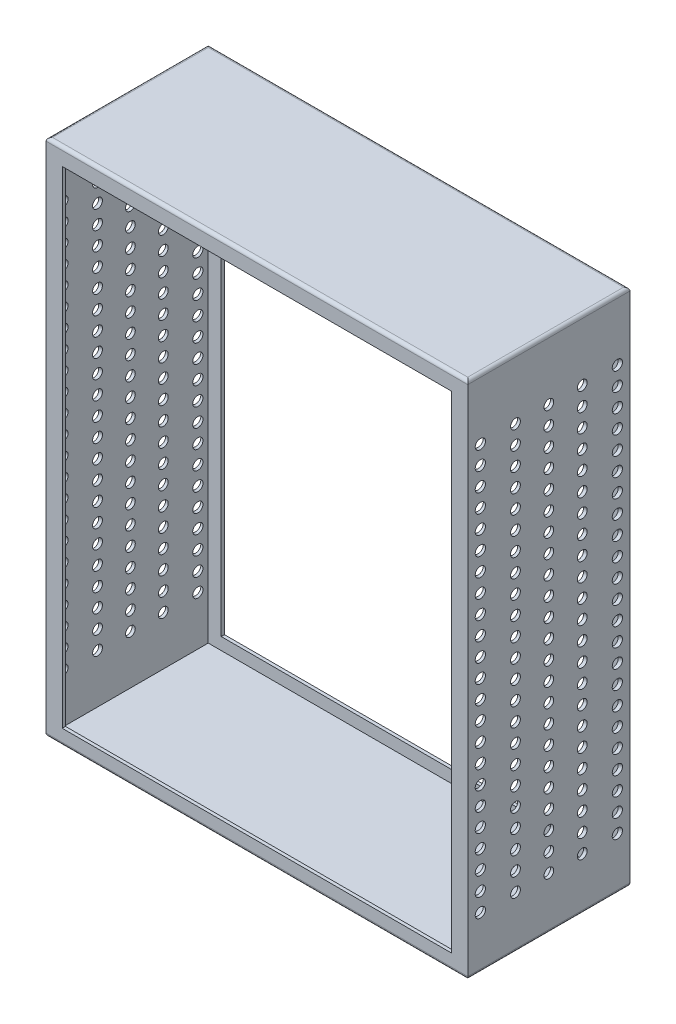
from build123d import *

# Parameters (mm, degrees)
SKETCH2_W               = 330.2
SKETCH2_H               = 406.4
BOSS_EXTRUDE1_DEPTH     = 127
FILLET1_R               = 2.54
FILLET2_R               = 2.54
SKETCH3_W               = 304.8
SKETCH3_H               = 381
CUT_EXTRUDE1_DEPTH      = 127
SHELL4_START            = 2.54
SHELL4_OUTLINE_W        = 401.32
SHELL4_OUTLINE_H        = 121.92
SHELL4_DEPTH            = 325.12
SKETCH6_R               = 3.81
CUT_EXTRUDE4_DEPTH      = 539.815367264
LPATTERN1_COUNT         = 23
LPATTERN1_PITCH         = 14.440000076
CIRPATTERN2_START       = 5.239496477
CIRPATTERN2_OUTLINE_R   = 3.81
CIRPATTERN2_DEPTH       = 335.522874171
CIRPATTERN2_START_2     = 1.807652619
CIRPATTERN2_2_OUTLINE_R = 3.81
CIRPATTERN2_2_DEPTH     = 349.668714729
CIRPATTERN2_START_3     = -37.437505667
CIRPATTERN2_3_OUTLINE_R = 3.81
CIRPATTERN2_3_DEPTH     = 349.668714729
CIRPATTERN2_START_4     = -14.627680583
CIRPATTERN2_4_OUTLINE_R = 3.81
CIRPATTERN2_4_DEPTH     = 335.52287417


# Read off the part's stored shape, not the designer's step: Shell4, CirPattern2
with BuildPart() as part:
    # Sketch2 → Boss-Extrude1 (new body)
    with BuildSketch(Plane.XY):
        with Locations((165.1, 203.2)):
            Rectangle(SKETCH2_W, SKETCH2_H)
    extrude(amount=BOSS_EXTRUDE1_DEPTH)

    # Fillet1
    fillet1_edges = [part.edges().sort_by_distance(p)[0] for p in [
        (165.1, 406.4, 127),
        (165.1, 406.4, 0),
        (0, 406.4, 63.5),
        (330.2, 406.4, 63.5),
    ]]
    fillet(fillet1_edges, radius=FILLET1_R)

    # Fillet2
    fillet2_edges = [part.edges().sort_by_distance(p)[0] for p in [
        (165.1, 0, 0),
        (330.2, 0, 63.5),
        (0, 0, 63.5),
        (165.1, 0, 127),
    ]]
    fillet(fillet2_edges, radius=FILLET2_R)

    # Sketch3 → Cut-Extrude1 (cut)
    with BuildSketch(Plane.XY.offset(127)):
        with Locations((165.1, 202.565)):
            Rectangle(SKETCH3_W, SKETCH3_H)
    extrude(amount=-CUT_EXTRUDE1_DEPTH, mode=Mode.SUBTRACT)

    # Shell4 outline → Shell4 (cut)
    with BuildSketch(Plane.YZ.offset(SHELL4_START)):
        with Locations((203.2, 63.5)):
            Rectangle(SHELL4_OUTLINE_W, SHELL4_OUTLINE_H)
    extrude(amount=SHELL4_DEPTH, mode=Mode.SUBTRACT)

    # Sketch6 → Cut-Extrude4 (cut, through all)
    with BuildSketch(Plane.ZY):
        with Locations((63.5, 358.605030272)):
            Circle(SKETCH6_R)
    cut_extrude4 = extrude(amount=-CUT_EXTRUDE4_DEPTH, mode=Mode.SUBTRACT)

    # LPattern1: Cut-Extrude4 ×23
    with Locations(*[(0, -i * LPATTERN1_PITCH, 0) for i in range(1, LPATTERN1_COUNT)]):
        add(cut_extrude4, mode=Mode.SUBTRACT)

    # CirPattern2 outline → CirPattern2 (cut)
    with BuildSketch(Plane(origin=(0, 0, 0), x_dir=(0, 1, 0), z_dir=(0.9876883405951378, 0, 0.15643446504023098)).offset(CIRPATTERN2_START)):
        with Locations((40.9250286, 36.89087945)):
            Circle(CIRPATTERN2_OUTLINE_R)
        with Locations((55.365028676, 36.89087945)):
            Circle(CIRPATTERN2_OUTLINE_R)
        with Locations((69.805028752, 36.89087945)):
            Circle(CIRPATTERN2_OUTLINE_R)
        with Locations((84.245028828, 36.89087945)):
            Circle(CIRPATTERN2_OUTLINE_R)
        with Locations((98.685028904, 36.89087945)):
            Circle(CIRPATTERN2_OUTLINE_R)
        with Locations((113.12502898, 36.89087945)):
            Circle(CIRPATTERN2_OUTLINE_R)
        with Locations((127.565029056, 36.89087945)):
            Circle(CIRPATTERN2_OUTLINE_R)
        with Locations((142.005029132, 36.89087945)):
            Circle(CIRPATTERN2_OUTLINE_R)
        with Locations((156.445029208, 36.89087945)):
            Circle(CIRPATTERN2_OUTLINE_R)
        with Locations((170.885029284, 36.89087945)):
            Circle(CIRPATTERN2_OUTLINE_R)
        with Locations((185.32502936, 36.89087945)):
            Circle(CIRPATTERN2_OUTLINE_R)
        with Locations((199.765029436, 36.89087945)):
            Circle(CIRPATTERN2_OUTLINE_R)
        with Locations((214.205029512, 36.89087945)):
            Circle(CIRPATTERN2_OUTLINE_R)
        with Locations((228.645029588, 36.89087945)):
            Circle(CIRPATTERN2_OUTLINE_R)
        with Locations((243.085029664, 36.89087945)):
            Circle(CIRPATTERN2_OUTLINE_R)
        with Locations((257.52502974, 36.89087945)):
            Circle(CIRPATTERN2_OUTLINE_R)
        with Locations((271.965029816, 36.89087945)):
            Circle(CIRPATTERN2_OUTLINE_R)
        with Locations((286.405029892, 36.89087945)):
            Circle(CIRPATTERN2_OUTLINE_R)
        with Locations((300.845029968, 36.89087945)):
            Circle(CIRPATTERN2_OUTLINE_R)
        with Locations((315.285030044, 36.89087945)):
            Circle(CIRPATTERN2_OUTLINE_R)
        with Locations((329.72503012, 36.89087945)):
            Circle(CIRPATTERN2_OUTLINE_R)
        with Locations((344.165030196, 36.89087945)):
            Circle(CIRPATTERN2_OUTLINE_R)
        with Locations((358.605030272, 36.89087945)):
            Circle(CIRPATTERN2_OUTLINE_R)
    extrude(amount=CIRPATTERN2_DEPTH, mode=Mode.SUBTRACT)

    # CirPattern2 2 outline → CirPattern2 2 (cut)
    with BuildSketch(Plane(origin=(0, 0, 0), x_dir=(0, 1, 0), z_dir=(0.9510565162951534, 0, 0.3090169943749481)).offset(CIRPATTERN2_START_2)):
        with Locations((40.9250286, 9.373383013)):
            Circle(CIRPATTERN2_2_OUTLINE_R)
        with Locations((55.365028676, 9.373383013)):
            Circle(CIRPATTERN2_2_OUTLINE_R)
        with Locations((69.805028752, 9.373383013)):
            Circle(CIRPATTERN2_2_OUTLINE_R)
        with Locations((84.245028828, 9.373383013)):
            Circle(CIRPATTERN2_2_OUTLINE_R)
        with Locations((98.685028904, 9.373383013)):
            Circle(CIRPATTERN2_2_OUTLINE_R)
        with Locations((113.12502898, 9.373383013)):
            Circle(CIRPATTERN2_2_OUTLINE_R)
        with Locations((127.565029056, 9.373383013)):
            Circle(CIRPATTERN2_2_OUTLINE_R)
        with Locations((142.005029132, 9.373383013)):
            Circle(CIRPATTERN2_2_OUTLINE_R)
        with Locations((156.445029208, 9.373383013)):
            Circle(CIRPATTERN2_2_OUTLINE_R)
        with Locations((170.885029284, 9.373383013)):
            Circle(CIRPATTERN2_2_OUTLINE_R)
        with Locations((185.32502936, 9.373383013)):
            Circle(CIRPATTERN2_2_OUTLINE_R)
        with Locations((199.765029436, 9.373383013)):
            Circle(CIRPATTERN2_2_OUTLINE_R)
        with Locations((214.205029512, 9.373383013)):
            Circle(CIRPATTERN2_2_OUTLINE_R)
        with Locations((228.645029588, 9.373383013)):
            Circle(CIRPATTERN2_2_OUTLINE_R)
        with Locations((243.085029664, 9.373383013)):
            Circle(CIRPATTERN2_2_OUTLINE_R)
        with Locations((257.52502974, 9.373383013)):
            Circle(CIRPATTERN2_2_OUTLINE_R)
        with Locations((271.965029816, 9.373383013)):
            Circle(CIRPATTERN2_2_OUTLINE_R)
        with Locations((286.405029892, 9.373383013)):
            Circle(CIRPATTERN2_2_OUTLINE_R)
        with Locations((300.845029968, 9.373383013)):
            Circle(CIRPATTERN2_2_OUTLINE_R)
        with Locations((315.285030044, 9.373383013)):
            Circle(CIRPATTERN2_2_OUTLINE_R)
        with Locations((329.72503012, 9.373383013)):
            Circle(CIRPATTERN2_2_OUTLINE_R)
        with Locations((344.165030196, 9.373383013)):
            Circle(CIRPATTERN2_2_OUTLINE_R)
        with Locations((358.605030272, 9.373383013)):
            Circle(CIRPATTERN2_2_OUTLINE_R)
    extrude(amount=CIRPATTERN2_2_DEPTH, mode=Mode.SUBTRACT)

    # CirPattern2 3 outline → CirPattern2 3 (cut)
    with BuildSketch(Plane(origin=(0, 0, 0), x_dir=(0, 1, 0), z_dir=(0.9510565162951558, 0, -0.30901699437494096)).offset(CIRPATTERN2_START_3)):
        with Locations((40.9250286, 111.410794556)):
            Circle(CIRPATTERN2_3_OUTLINE_R)
        with Locations((55.365028676, 111.410794556)):
            Circle(CIRPATTERN2_3_OUTLINE_R)
        with Locations((69.805028752, 111.410794556)):
            Circle(CIRPATTERN2_3_OUTLINE_R)
        with Locations((84.245028828, 111.410794556)):
            Circle(CIRPATTERN2_3_OUTLINE_R)
        with Locations((98.685028904, 111.410794556)):
            Circle(CIRPATTERN2_3_OUTLINE_R)
        with Locations((113.12502898, 111.410794556)):
            Circle(CIRPATTERN2_3_OUTLINE_R)
        with Locations((127.565029056, 111.410794556)):
            Circle(CIRPATTERN2_3_OUTLINE_R)
        with Locations((142.005029132, 111.410794556)):
            Circle(CIRPATTERN2_3_OUTLINE_R)
        with Locations((156.445029208, 111.410794556)):
            Circle(CIRPATTERN2_3_OUTLINE_R)
        with Locations((170.885029284, 111.410794556)):
            Circle(CIRPATTERN2_3_OUTLINE_R)
        with Locations((185.32502936, 111.410794556)):
            Circle(CIRPATTERN2_3_OUTLINE_R)
        with Locations((199.765029436, 111.410794556)):
            Circle(CIRPATTERN2_3_OUTLINE_R)
        with Locations((214.205029512, 111.410794556)):
            Circle(CIRPATTERN2_3_OUTLINE_R)
        with Locations((228.645029588, 111.410794556)):
            Circle(CIRPATTERN2_3_OUTLINE_R)
        with Locations((243.085029664, 111.410794556)):
            Circle(CIRPATTERN2_3_OUTLINE_R)
        with Locations((257.52502974, 111.410794556)):
            Circle(CIRPATTERN2_3_OUTLINE_R)
        with Locations((271.965029816, 111.410794556)):
            Circle(CIRPATTERN2_3_OUTLINE_R)
        with Locations((286.405029892, 111.410794556)):
            Circle(CIRPATTERN2_3_OUTLINE_R)
        with Locations((300.845029968, 111.410794556)):
            Circle(CIRPATTERN2_3_OUTLINE_R)
        with Locations((315.285030044, 111.410794556)):
            Circle(CIRPATTERN2_3_OUTLINE_R)
        with Locations((329.72503012, 111.410794556)):
            Circle(CIRPATTERN2_3_OUTLINE_R)
        with Locations((344.165030196, 111.410794556)):
            Circle(CIRPATTERN2_3_OUTLINE_R)
        with Locations((358.605030272, 111.410794556)):
            Circle(CIRPATTERN2_3_OUTLINE_R)
    extrude(amount=CIRPATTERN2_3_DEPTH, mode=Mode.SUBTRACT)

    # CirPattern2 4 outline → CirPattern2 4 (cut)
    with BuildSketch(Plane(origin=(0, 0, 0), x_dir=(0, 1, 0), z_dir=(0.9876883405951389, 0, -0.156434465040224)).offset(CIRPATTERN2_START_4)):
        with Locations((40.9250286, 88.545539806)):
            Circle(CIRPATTERN2_4_OUTLINE_R)
        with Locations((55.365028676, 88.545539806)):
            Circle(CIRPATTERN2_4_OUTLINE_R)
        with Locations((69.805028752, 88.545539806)):
            Circle(CIRPATTERN2_4_OUTLINE_R)
        with Locations((84.245028828, 88.545539806)):
            Circle(CIRPATTERN2_4_OUTLINE_R)
        with Locations((98.685028904, 88.545539806)):
            Circle(CIRPATTERN2_4_OUTLINE_R)
        with Locations((113.12502898, 88.545539806)):
            Circle(CIRPATTERN2_4_OUTLINE_R)
        with Locations((127.565029056, 88.545539806)):
            Circle(CIRPATTERN2_4_OUTLINE_R)
        with Locations((142.005029132, 88.545539806)):
            Circle(CIRPATTERN2_4_OUTLINE_R)
        with Locations((156.445029208, 88.545539806)):
            Circle(CIRPATTERN2_4_OUTLINE_R)
        with Locations((170.885029284, 88.545539806)):
            Circle(CIRPATTERN2_4_OUTLINE_R)
        with Locations((185.32502936, 88.545539806)):
            Circle(CIRPATTERN2_4_OUTLINE_R)
        with Locations((199.765029436, 88.545539806)):
            Circle(CIRPATTERN2_4_OUTLINE_R)
        with Locations((214.205029512, 88.545539806)):
            Circle(CIRPATTERN2_4_OUTLINE_R)
        with Locations((228.645029588, 88.545539806)):
            Circle(CIRPATTERN2_4_OUTLINE_R)
        with Locations((243.085029664, 88.545539806)):
            Circle(CIRPATTERN2_4_OUTLINE_R)
        with Locations((257.52502974, 88.545539806)):
            Circle(CIRPATTERN2_4_OUTLINE_R)
        with Locations((271.965029816, 88.545539806)):
            Circle(CIRPATTERN2_4_OUTLINE_R)
        with Locations((286.405029892, 88.545539806)):
            Circle(CIRPATTERN2_4_OUTLINE_R)
        with Locations((300.845029968, 88.545539806)):
            Circle(CIRPATTERN2_4_OUTLINE_R)
        with Locations((315.285030044, 88.545539806)):
            Circle(CIRPATTERN2_4_OUTLINE_R)
        with Locations((329.72503012, 88.545539806)):
            Circle(CIRPATTERN2_4_OUTLINE_R)
        with Locations((344.165030196, 88.545539806)):
            Circle(CIRPATTERN2_4_OUTLINE_R)
        with Locations((358.605030272, 88.545539806)):
            Circle(CIRPATTERN2_4_OUTLINE_R)
    extrude(amount=CIRPATTERN2_4_DEPTH, mode=Mode.SUBTRACT)


solid = part.part
